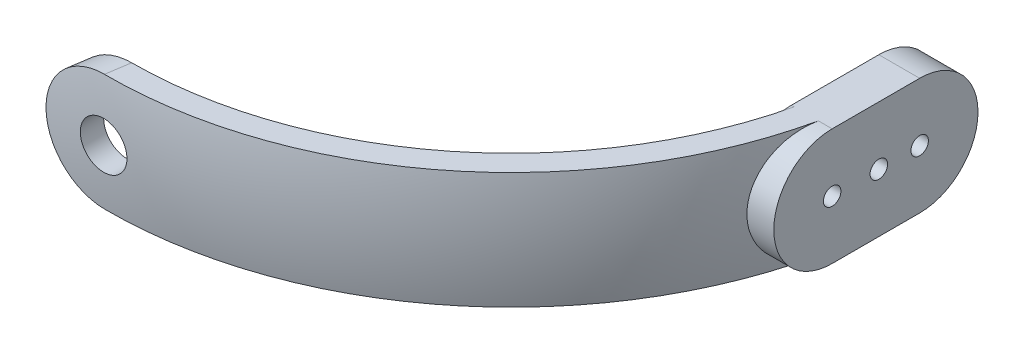
from build123d import *

# Parameters (mm, degrees)
REVOLVE_1_ANGLE           = 98.68117871
REVOLVE_1_OTHER_WAY_ANGLE = 8.68117871
SKETCH_3_R                = 4
CUT_EXTRUDE_1_DEPTH       = 100.498743711
SKETCH_4_R                = 1.5
CUT_EXTRUDE_2_DEPTH       = 100.41830825
CUT_EXTRUDE_3_DEPTH       = 102.960221512
FILLET_1_R                = 10
EXTRUDE_START             = -7
SKETCH_8_R                = 1.5
EXTRUDE_1_DEPTH           = 7


with BuildPart() as part:
    # 草图2 → 旋转1 (revolve)
    with BuildSketch(Plane.XY):
        with BuildLine():
            Line((65.238025721, 10), (69.282032303, 10))
            ThreePointArc((69.282032303, 10), (70, 0), (69.282032303, -10))
            Line((69.282032303, -10), (65.238025721, -10))
            ThreePointArc((65.238025721, -10), (66, 0), (65.238025721, 10))
        make_face()
    revolve(axis=Axis((0, 0, 0), (0, -1, 0)), revolution_arc=REVOLVE_1_ANGLE)

    # 草图2 → 旋转1 other way (revolve)
    with BuildSketch(Plane.XY):
        with BuildLine():
            Line((65.238025721, 10), (69.282032303, 10))
            ThreePointArc((69.282032303, 10), (70, 0), (69.282032303, -10))
            Line((69.282032303, -10), (65.238025721, -10))
            ThreePointArc((65.238025721, -10), (66, 0), (65.238025721, 10))
        make_face()
    revolve(axis=Axis((0, 0, 0), (0, 1, 0)), revolution_arc=REVOLVE_1_OTHER_WAY_ANGLE)

    # 草图3 → 切除-拉伸1 (cut, through all)
    with BuildSketch(Plane.XY):
        with Locations(Location((0, 0, 0), (0, 0, 180))):
            Circle(SKETCH_3_R)
    extrude(amount=CUT_EXTRUDE_1_DEPTH, mode=Mode.SUBTRACT)

    # 草图4 → 切除-拉伸2 (cut, through all)
    with BuildSketch(Plane(origin=(0, 0, 0), x_dir=(0, 0, -1), z_dir=(1, 0, 0))):
        with Locations(Location((0, 0, 0), (0, 0, 180))):
            Circle(SKETCH_4_R)
    extrude(amount=CUT_EXTRUDE_2_DEPTH, mode=Mode.SUBTRACT)

    # 草图7 → 切除-拉伸3 (cut, through all)
    with BuildSketch(Plane(origin=(63, 0, 0), x_dir=(0, 0, -1), z_dir=(1, 0, 0))):
        with BuildLine():
            Line((25, -10), (-15, -10))
            ThreePointArc((-15, -10), (-25, 0), (-15, 10))
            Line((-15, 10), (25, 10))
            Line((25, 10), (25, -10))
        make_face()
    extrude(amount=CUT_EXTRUDE_3_DEPTH, mode=Mode.SUBTRACT)

    # 圆角1
    # the kernel refuses this fillet: 10 mm, written as the material it takes off along each edge
    with BuildSketch(Plane(origin=(-6.073370605, 10, 39.777039651), x_dir=(0.9885435216678339, 0, 0.15093609829512958), z_dir=(-0.15093609829512958, 0, 0.9885435216678339)), Plane(origin=(-14.230562095, -10, 93.201892243), x_dir=(0.9885435216678339, 0, 0.15093609829512958), z_dir=(0.15093609829512958, 0, -0.9885435216678339))) as fillet_1_piece_1:
        with BuildLine():
            CenterArc((FILLET_1_R, -FILLET_1_R), FILLET_1_R, 90, 90)
            Line((0, -FILLET_1_R), (0, 0))
            Line((0, 0), (FILLET_1_R, 0))
        make_face()
    extrude(amount=54.044006582, mode=Mode.SUBTRACT)

    # 草图8 → 凸台-拉伸1 (add)
    with BuildSketch(Plane(origin=(70, 0, 0), x_dir=(0, 0, -1), z_dir=(1, 0, 0)).offset(EXTRUDE_START)):
        with BuildLine():
            Line((-15, 10), (0, 10))
            ThreePointArc((0, 10), (10, 0), (0, -10))
            Line((0, -10), (-15, -10))
            ThreePointArc((-15, -10), (-25, 0), (-15, 10))
        make_face()
        Circle(SKETCH_8_R, mode=Mode.SUBTRACT)
        with Locations((-7, 0)):
            Circle(SKETCH_8_R, mode=Mode.SUBTRACT)
        with Locations((-15, 0)):
            Circle(SKETCH_8_R, mode=Mode.SUBTRACT)
    extrude(amount=EXTRUDE_1_DEPTH)


solid = part.part
